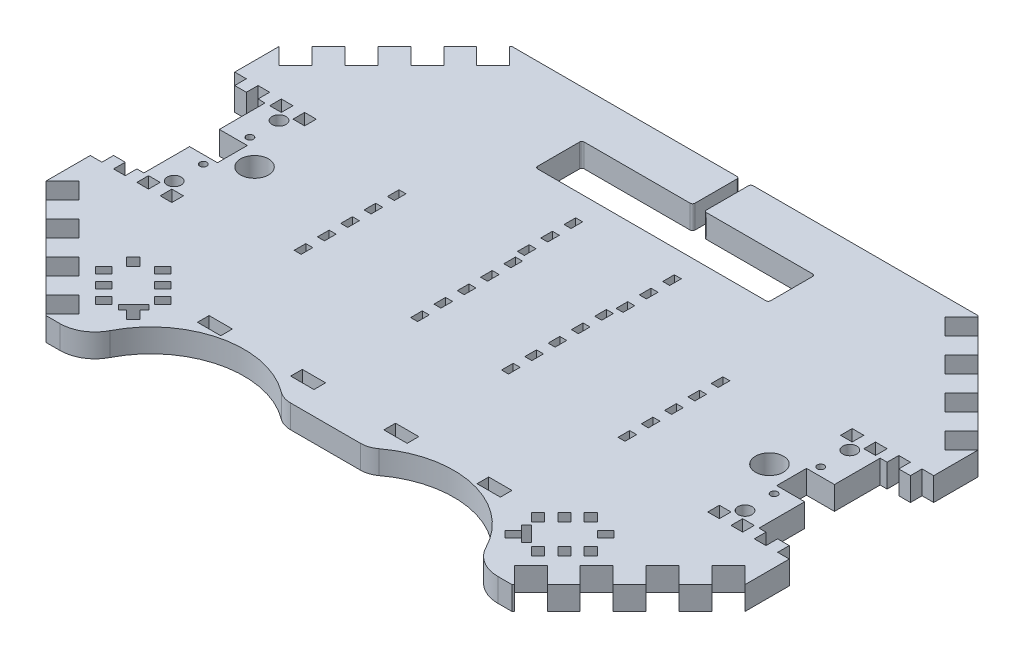
from build123d import *

# Parameters (mm, degrees)
ESQUISSE1_W                     = 300
ESQUISSE1_H                     = 200
BOSS_EXTRU_1_DEPTH              = 10
ENL_V_MAT_EXTRU_1_DEPTH         = 10
ESQUISSE4_W                     = 3
ESQUISSE4_H                     = 5
ENL_V_MAT_EXTRU_3_DEPTH         = 10
R_P_TITION_LIN_AIRE1_COUNT      = 5
R_P_TITION_LIN_AIRE1_PITCH      = 10
R_P_TITION_LIN_AIRE1_COUNT_DIR2 = 2
R_P_TITION_LIN_AIRE1_PITCH_DIR2 = 50
ESQUISSE8_R                     = 3
ENL_V_MAT_EXTRU_6_DEPTH         = 10
ESQUISSE14_R                    = 6
ESQUISSE14_R_2                  = 1.5
ENL_V_MAT_EXTRU_13_DEPTH        = 10
SYM_TRIE1_COPY_1_SKETCH_W       = 3
SYM_TRIE1_COPY_1_SKETCH_H       = 5
SYM_TRIE1_COPY_1_DEPTH          = 10
SYM_TRIE1_COPY_2_SKETCH_W       = 3
SYM_TRIE1_COPY_2_SKETCH_H       = 5
SYM_TRIE1_COPY_2_DEPTH          = 10
SYM_TRIE1_COPY_3_SKETCH_W       = 3
SYM_TRIE1_COPY_3_SKETCH_H       = 5
SYM_TRIE1_COPY_3_DEPTH          = 10
SYM_TRIE1_COPY_4_SKETCH_W       = 3
SYM_TRIE1_COPY_4_SKETCH_H       = 5
SYM_TRIE1_COPY_4_DEPTH          = 10
SYM_TRIE1_COPY_5_SKETCH_W       = 3
SYM_TRIE1_COPY_5_SKETCH_H       = 5
SYM_TRIE1_COPY_5_DEPTH          = 10
SYM_TRIE1_COPY_6_SKETCH_W       = 3
SYM_TRIE1_COPY_6_SKETCH_H       = 5
SYM_TRIE1_COPY_6_DEPTH          = 10
SYM_TRIE1_COPY_7_SKETCH_W       = 3
SYM_TRIE1_COPY_7_SKETCH_H       = 5
SYM_TRIE1_COPY_7_DEPTH          = 10
SYM_TRIE1_COPY_8_SKETCH_W       = 3
SYM_TRIE1_COPY_8_SKETCH_H       = 5
SYM_TRIE1_COPY_8_DEPTH          = 10
SYM_TRIE1_COPY_9_SKETCH_W       = 3
SYM_TRIE1_COPY_9_SKETCH_H       = 5
SYM_TRIE1_COPY_9_DEPTH          = 10
ESQUISSE3_R                     = 40
ENL_V_MAT_EXTRU_7_DEPTH         = 10
CONG_1_R                        = 15
ENL_V_MAT_EXTRU_11_DEPTH        = 10
R_P_TITION_LIN_AIRE2_COUNT      = 4
R_P_TITION_LIN_AIRE2_PITCH      = 20
SYM_TRIE2_COPY_1_DEPTH          = 10
SYM_TRIE2_COPY_2_DEPTH          = 10
SYM_TRIE2_COPY_3_DEPTH          = 10
SYM_TRIE3_COPY_1_DEPTH          = 10
SYM_TRIE3_COPY_2_DEPTH          = 10
SYM_TRIE3_COPY_3_DEPTH          = 10
SYM_TRIE3_COPY_4_DEPTH          = 10
SYM_TRIE3_COPY_5_DEPTH          = 10
SYM_TRIE3_COPY_6_DEPTH          = 10
SYM_TRIE3_COPY_7_DEPTH          = 10
ESQUISSE17_W                    = 10
ESQUISSE17_H                    = 5
ENL_V_MAT_EXTRU_16_DEPTH        = 10
R_P_TITION_LIN_AIRE3_COUNT      = 4
R_P_TITION_LIN_AIRE3_PITCH      = 40
ESQUISSE21_W                    = 43.542486889
ESQUISSE21_H                    = 20
ENL_V_MAT_EXTRU_20_DEPTH        = 10
CONG_2_R                        = 10
ESQUISSE22_W                    = 5
ESQUISSE22_H                    = 5
ENL_V_MAT_EXTRU_21_DEPTH        = 10
ESQUISSE23_W                    = 100
ESQUISSE23_H                    = 20
ENL_V_MAT_EXTRU_22_DEPTH        = 10
ESQUISSE24_W                    = 5
ESQUISSE24_H                    = 20
ENL_V_MAT_EXTRU_23_DEPTH        = 10
CONG_3_R                        = 1
ESQUISSE26_W                    = 3
ESQUISSE26_H                    = 5
ENL_V_MAT_EXTRU_25_DEPTH        = 10
ENL_V_MAT_EXTRU_26_DEPTH        = 10
ESQUISSE30_W                    = 18
ESQUISSE30_H                    = 52
ENL_V_MAT_EXTRU_27_DEPTH        = 10
ESQUISSE32_W                    = 12
ESQUISSE32_H                    = 12.8
ENL_V_MAT_EXTRU_28_DEPTH        = 10


with BuildPart() as part:
    # Esquisse1 → Boss.-Extru.1 (new body)
    with BuildSketch(Plane(origin=(0, 0, 0), x_dir=(1, 0, 0), z_dir=(0, 1, 0))):
        Rectangle(ESQUISSE1_W, ESQUISSE1_H)
    extrude(amount=BOSS_EXTRU_1_DEPTH)

    # Esquisse2 → Enlèv. mat.-Extru.1 (cut)
    with BuildSketch(Plane(origin=(0, 10, 0), x_dir=(1, 0, 0), z_dir=(0, 1, 0))):
        Polygon((-100, 100), (-150, 50), (-150, 100), align=None)
        Polygon((150, 100), (150, 50), (100, 100), align=None)
        Polygon((150, -100), (150, -50), (100, -100), align=None)
        Polygon((-100, -100), (-150, -100), (-150, -50), align=None)
    extrude(amount=-ENL_V_MAT_EXTRU_1_DEPTH, mode=Mode.SUBTRACT)

    # Esquisse4 → Enlèv. mat.-Extru.3 (cut)
    with BuildSketch(Plane(origin=(0, 10, 0), x_dir=(1, 0, 0), z_dir=(0, 1, 0))):
        with Locations((-19.5, 20)):
            Rectangle(ESQUISSE4_W, ESQUISSE4_H)
    enl_v_mat_extru_3 = extrude(amount=-ENL_V_MAT_EXTRU_3_DEPTH, mode=Mode.SUBTRACT)

    # Répétition linéaire1: Enl_v. mat.-Extru.3 5 × 2
    with Locations(*[(-j * R_P_TITION_LIN_AIRE1_PITCH_DIR2, 0, i * R_P_TITION_LIN_AIRE1_PITCH) for i in range(R_P_TITION_LIN_AIRE1_COUNT) for j in range(R_P_TITION_LIN_AIRE1_COUNT_DIR2) if (i, j) != (0, 0)]):
        add(enl_v_mat_extru_3, mode=Mode.SUBTRACT)

    # Esquisse8 → Enlèv. mat.-Extru.6 (cut)
    with BuildSketch(Plane(origin=(0, 10, 0), x_dir=(1, 0, 0), z_dir=(0, 1, 0))):
        with Locations(Location((-122.5, 22.5, 0), (0, 0, 270))):
            Circle(ESQUISSE8_R)
        with Locations(Location((-122.5, -22.5, 0), (0, 0, 270))):
            Circle(ESQUISSE8_R)
    enl_v_mat_extru_6 = extrude(amount=-ENL_V_MAT_EXTRU_6_DEPTH, mode=Mode.SUBTRACT)

    # Esquisse14 → Enlèv. mat.-Extru.13 (cut)
    with BuildSketch(Plane(origin=(0, 10, 0), x_dir=(1, 0, 0), z_dir=(0, 1, 0))):
        with Locations(Location((-110.5, 0, 0), (0, 0, 270))):
            Circle(ESQUISSE14_R)
        with Locations(Location((-122.5, 10, 0), (0, 0, 270))):
            Circle(ESQUISSE14_R_2)
        with Locations(Location((-122.5, -10, 0), (0, 0, 270))):
            Circle(ESQUISSE14_R_2)
    enl_v_mat_extru_13 = extrude(amount=-ENL_V_MAT_EXTRU_13_DEPTH, mode=Mode.SUBTRACT)

    # Symétrie1: Enlèv. mat.-Extru.3, Enlèv. mat.-Extru.6, Enlèv. mat.-Extru.13 across plane
    add(enl_v_mat_extru_3.mirror(Plane(origin=(0, 0, 0), x_dir=(0, 0, 1), z_dir=(1, 0, 0))), mode=Mode.SUBTRACT)
    add(enl_v_mat_extru_6.mirror(Plane(origin=(0, 0, 0), x_dir=(0, 0, 1), z_dir=(1, 0, 0))), mode=Mode.SUBTRACT)
    add(enl_v_mat_extru_13.mirror(Plane(origin=(0, 0, 0), x_dir=(0, 0, 1), z_dir=(1, 0, 0))), mode=Mode.SUBTRACT)

    # Symétrie1 copy 1 sketch → Symétrie1 copy 1 (cut)
    with BuildSketch(Plane(origin=(50, 10, 0), x_dir=(-1, 0, 0), z_dir=(0, 1, 0))):
        with Locations((-19.5, -20)):
            Rectangle(SYM_TRIE1_COPY_1_SKETCH_W, SYM_TRIE1_COPY_1_SKETCH_H)
    extrude(amount=-SYM_TRIE1_COPY_1_DEPTH, mode=Mode.SUBTRACT)

    # Symétrie1 copy 2 sketch → Symétrie1 copy 2 (cut)
    with BuildSketch(Plane(origin=(0, 10, 10), x_dir=(-1, 0, 0), z_dir=(0, 1, 0))):
        with Locations((-19.5, -20)):
            Rectangle(SYM_TRIE1_COPY_2_SKETCH_W, SYM_TRIE1_COPY_2_SKETCH_H)
    extrude(amount=-SYM_TRIE1_COPY_2_DEPTH, mode=Mode.SUBTRACT)

    # Symétrie1 copy 3 sketch → Symétrie1 copy 3 (cut)
    with BuildSketch(Plane(origin=(50, 10, 10), x_dir=(-1, 0, 0), z_dir=(0, 1, 0))):
        with Locations((-19.5, -20)):
            Rectangle(SYM_TRIE1_COPY_3_SKETCH_W, SYM_TRIE1_COPY_3_SKETCH_H)
    extrude(amount=-SYM_TRIE1_COPY_3_DEPTH, mode=Mode.SUBTRACT)

    # Symétrie1 copy 4 sketch → Symétrie1 copy 4 (cut)
    with BuildSketch(Plane(origin=(0, 10, 20), x_dir=(-1, 0, 0), z_dir=(0, 1, 0))):
        with Locations((-19.5, -20)):
            Rectangle(SYM_TRIE1_COPY_4_SKETCH_W, SYM_TRIE1_COPY_4_SKETCH_H)
    extrude(amount=-SYM_TRIE1_COPY_4_DEPTH, mode=Mode.SUBTRACT)

    # Symétrie1 copy 5 sketch → Symétrie1 copy 5 (cut)
    with BuildSketch(Plane(origin=(50, 10, 20), x_dir=(-1, 0, 0), z_dir=(0, 1, 0))):
        with Locations((-19.5, -20)):
            Rectangle(SYM_TRIE1_COPY_5_SKETCH_W, SYM_TRIE1_COPY_5_SKETCH_H)
    extrude(amount=-SYM_TRIE1_COPY_5_DEPTH, mode=Mode.SUBTRACT)

    # Symétrie1 copy 6 sketch → Symétrie1 copy 6 (cut)
    with BuildSketch(Plane(origin=(0, 10, 30), x_dir=(-1, 0, 0), z_dir=(0, 1, 0))):
        with Locations((-19.5, -20)):
            Rectangle(SYM_TRIE1_COPY_6_SKETCH_W, SYM_TRIE1_COPY_6_SKETCH_H)
    extrude(amount=-SYM_TRIE1_COPY_6_DEPTH, mode=Mode.SUBTRACT)

    # Symétrie1 copy 7 sketch → Symétrie1 copy 7 (cut)
    with BuildSketch(Plane(origin=(50, 10, 30), x_dir=(-1, 0, 0), z_dir=(0, 1, 0))):
        with Locations((-19.5, -20)):
            Rectangle(SYM_TRIE1_COPY_7_SKETCH_W, SYM_TRIE1_COPY_7_SKETCH_H)
    extrude(amount=-SYM_TRIE1_COPY_7_DEPTH, mode=Mode.SUBTRACT)

    # Symétrie1 copy 8 sketch → Symétrie1 copy 8 (cut)
    with BuildSketch(Plane(origin=(0, 10, 40), x_dir=(-1, 0, 0), z_dir=(0, 1, 0))):
        with Locations((-19.5, -20)):
            Rectangle(SYM_TRIE1_COPY_8_SKETCH_W, SYM_TRIE1_COPY_8_SKETCH_H)
    extrude(amount=-SYM_TRIE1_COPY_8_DEPTH, mode=Mode.SUBTRACT)

    # Symétrie1 copy 9 sketch → Symétrie1 copy 9 (cut)
    with BuildSketch(Plane(origin=(50, 10, 40), x_dir=(-1, 0, 0), z_dir=(0, 1, 0))):
        with Locations((-19.5, -20)):
            Rectangle(SYM_TRIE1_COPY_9_SKETCH_W, SYM_TRIE1_COPY_9_SKETCH_H)
    extrude(amount=-SYM_TRIE1_COPY_9_DEPTH, mode=Mode.SUBTRACT)

    # Esquisse3 → Enlèv. mat.-Extru.7 (cut)
    with BuildSketch(Plane(origin=(0, 10, 0), x_dir=(1, 0, 0), z_dir=(0, 1, 0))):
        with Locations((-45, -110)):
            Circle(ESQUISSE3_R)
        with Locations((45, -110)):
            Circle(ESQUISSE3_R)
    extrude(amount=-ENL_V_MAT_EXTRU_7_DEPTH, mode=Mode.SUBTRACT)

    # Congé1
    # the kernel refuses this fillet: 15 mm, written as the material it takes off along each edge
    with BuildSketch(Plane(origin=(-6.270166538, -25.649903484, 100), x_dir=(-0.35439878792981183, 0, -0.9350943797894843), z_dir=(0, 1, 0)), Plane(origin=(83.729833462, -25.649903484, 100), x_dir=(-0.3543987879298129, 0, -0.9350943797894838), z_dir=(0, 1, 0))) as cong_1_piece_1:
        with BuildLine():
            CenterArc((10.390297815, -14.910014055), CONG_1_R, 96.279089802, 62.964308211)
            Line((-3.636117882, -9.594032236), (0, 0))
            ThreePointArc((0, 0), (4.374862238, -0.23996252), (8.749724476, 0))
        make_face()
    extrude(amount=61.299806968, mode=Mode.SUBTRACT)
    with BuildSketch(Plane(origin=(-83.729833462, -25.649903484, 100), x_dir=(-1, 0, 0), z_dir=(0, 1, 0)), Plane(origin=(6.270166538, -25.649903484, 100), x_dir=(-1, 0, 0), z_dir=(0, 1, 0))) as cong_1_piece_2:
        with BuildLine():
            CenterArc((10.259961394, -15), CONG_1_R, 90, 62.964308211)
            ThreePointArc((-3.100891749, -8.181818182), (-1.32605827, -4.175951517), (0, 0))
            Line((0, 0), (10.259961394, 0))
        make_face()
    extrude(amount=61.299806968, mode=Mode.SUBTRACT)

    # Esquisse12 → Enlèv. mat.-Extru.11 (cut)
    with BuildSketch(Plane(origin=(0, 10, 0), x_dir=(1, 0, 0), z_dir=(0, 1, 0))):
        Polygon((-150, 50), (-142.928932188, 57.071067812), (-135.857864376, 50), (-142.928932188, 42.928932188), align=None)
    enl_v_mat_extru_11 = extrude(amount=-ENL_V_MAT_EXTRU_11_DEPTH, mode=Mode.SUBTRACT)

    # Répétition linéaire2: Enlèv. mat.-Extru.11 ×4
    with Locations(*[Vector(0.7071067811865476, 0, -0.7071067811865475) * (i * R_P_TITION_LIN_AIRE2_PITCH) for i in range(1, R_P_TITION_LIN_AIRE2_COUNT)]):
        add(enl_v_mat_extru_11, mode=Mode.SUBTRACT)

    # Symétrie2: Enlèv. mat.-Extru.11 across plane
    add(enl_v_mat_extru_11.mirror(Plane.XY), mode=Mode.SUBTRACT)

    # Symétrie2 copy 1 sketch → Symétrie2 copy 1 (cut)
    with BuildSketch(Plane(origin=(14.142135624, 10, 14.142135624), x_dir=(1, 0, 0), z_dir=(0, 1, 0))):
        Polygon((-150, -50), (-142.928932188, -57.071067812), (-135.857864376, -50), (-142.928932188, -42.928932188), align=None)
    extrude(amount=-SYM_TRIE2_COPY_1_DEPTH, mode=Mode.SUBTRACT)

    # Symétrie2 copy 2 sketch → Symétrie2 copy 2 (cut)
    with BuildSketch(Plane(origin=(28.284271247, 10, 28.284271247), x_dir=(1, 0, 0), z_dir=(0, 1, 0))):
        Polygon((-150, -50), (-142.928932188, -57.071067812), (-135.857864376, -50), (-142.928932188, -42.928932188), align=None)
    extrude(amount=-SYM_TRIE2_COPY_2_DEPTH, mode=Mode.SUBTRACT)

    # Symétrie2 copy 3 sketch → Symétrie2 copy 3 (cut)
    with BuildSketch(Plane(origin=(42.426406871, 10, 42.426406871), x_dir=(1, 0, 0), z_dir=(0, 1, 0))):
        Polygon((-150, -50), (-142.928932188, -57.071067812), (-135.857864376, -50), (-142.928932188, -42.928932188), align=None)
    extrude(amount=-SYM_TRIE2_COPY_3_DEPTH, mode=Mode.SUBTRACT)

    # Symétrie3: Enlèv. mat.-Extru.11 across plane
    add(enl_v_mat_extru_11.mirror(Plane(origin=(0, 0, 0), x_dir=(0, 0, 1), z_dir=(1, 0, 0))), mode=Mode.SUBTRACT)

    # Symétrie3 copy 1 sketch → Symétrie3 copy 1 (cut)
    with BuildSketch(Plane(origin=(-14.142135624, 10, -14.142135624), x_dir=(-1, 0, 0), z_dir=(0, 1, 0))):
        Polygon((-150, -50), (-142.928932188, -57.071067812), (-135.857864376, -50), (-142.928932188, -42.928932188), align=None)
    extrude(amount=-SYM_TRIE3_COPY_1_DEPTH, mode=Mode.SUBTRACT)

    # Symétrie3 copy 2 sketch → Symétrie3 copy 2 (cut)
    with BuildSketch(Plane(origin=(-28.284271247, 10, -28.284271247), x_dir=(-1, 0, 0), z_dir=(0, 1, 0))):
        Polygon((-150, -50), (-142.928932188, -57.071067812), (-135.857864376, -50), (-142.928932188, -42.928932188), align=None)
    extrude(amount=-SYM_TRIE3_COPY_2_DEPTH, mode=Mode.SUBTRACT)

    # Symétrie3 copy 3 sketch → Symétrie3 copy 3 (cut)
    with BuildSketch(Plane(origin=(-42.426406871, 10, -42.426406871), x_dir=(-1, 0, 0), z_dir=(0, 1, 0))):
        Polygon((-150, -50), (-142.928932188, -57.071067812), (-135.857864376, -50), (-142.928932188, -42.928932188), align=None)
    extrude(amount=-SYM_TRIE3_COPY_3_DEPTH, mode=Mode.SUBTRACT)

    # Symétrie3 copy 4 sketch → Symétrie3 copy 4 (cut)
    with BuildSketch(Plane(origin=(0, 10, 0), x_dir=(-1, 0, 0), z_dir=(0, 1, 0))):
        Polygon((-150, 50), (-142.928932188, 57.071067812), (-135.857864376, 50), (-142.928932188, 42.928932188), align=None)
    extrude(amount=-SYM_TRIE3_COPY_4_DEPTH, mode=Mode.SUBTRACT)

    # Symétrie3 copy 5 sketch → Symétrie3 copy 5 (cut)
    with BuildSketch(Plane(origin=(-14.142135624, 10, 14.142135624), x_dir=(-1, 0, 0), z_dir=(0, 1, 0))):
        Polygon((-150, 50), (-142.928932188, 57.071067812), (-135.857864376, 50), (-142.928932188, 42.928932188), align=None)
    extrude(amount=-SYM_TRIE3_COPY_5_DEPTH, mode=Mode.SUBTRACT)

    # Symétrie3 copy 6 sketch → Symétrie3 copy 6 (cut)
    with BuildSketch(Plane(origin=(-28.284271247, 10, 28.284271247), x_dir=(-1, 0, 0), z_dir=(0, 1, 0))):
        Polygon((-150, 50), (-142.928932188, 57.071067812), (-135.857864376, 50), (-142.928932188, 42.928932188), align=None)
    extrude(amount=-SYM_TRIE3_COPY_6_DEPTH, mode=Mode.SUBTRACT)

    # Symétrie3 copy 7 sketch → Symétrie3 copy 7 (cut)
    with BuildSketch(Plane(origin=(-42.426406871, 10, 42.426406871), x_dir=(-1, 0, 0), z_dir=(0, 1, 0))):
        Polygon((-150, 50), (-142.928932188, 57.071067812), (-135.857864376, 50), (-142.928932188, 42.928932188), align=None)
    extrude(amount=-SYM_TRIE3_COPY_7_DEPTH, mode=Mode.SUBTRACT)

    # Esquisse17 → Enlèv. mat.-Extru.16 (cut)
    with BuildSketch(Plane(origin=(0, 10, 0), x_dir=(1, 0, 0), z_dir=(0, 1, 0))):
        with Locations((-60, -67.5)):
            Rectangle(ESQUISSE17_W, ESQUISSE17_H)
    enl_v_mat_extru_16 = extrude(amount=-ENL_V_MAT_EXTRU_16_DEPTH, mode=Mode.SUBTRACT)

    # Répétition linéaire3: Enlèv. mat.-Extru.16 ×4
    with Locations(*[(i * R_P_TITION_LIN_AIRE3_PITCH, 0, 0) for i in range(1, R_P_TITION_LIN_AIRE3_COUNT)]):
        add(enl_v_mat_extru_16, mode=Mode.SUBTRACT)

    # Esquisse21 → Enlèv. mat.-Extru.20 (cut)
    with BuildSketch(Plane(origin=(0, 10, 0), x_dir=(1, 0, 0), z_dir=(0, 1, 0))):
        with Locations((3.228756555, -90)):
            Rectangle(ESQUISSE21_W, ESQUISSE21_H)
    extrude(amount=-ENL_V_MAT_EXTRU_20_DEPTH, mode=Mode.SUBTRACT)

    # Congé2
    cong_2_edges = [part.edges().sort_by_distance(p)[0] for p in [
        (18.542486889, 5, 80),
        (-18.542486889, 5, 80),
    ]]
    fillet(cong_2_edges, radius=CONG_2_R)

    # Esquisse22 → Enlèv. mat.-Extru.21 (cut)
    with BuildSketch(Plane(origin=(0, 10, 0), x_dir=(1, 0, 0), z_dir=(0, 1, 0))):
        with Locations((-137.5, 28.5)):
            Rectangle(ESQUISSE22_W, ESQUISSE22_H)
        with Locations((-117.5, 28.5)):
            Rectangle(ESQUISSE22_W, ESQUISSE22_H)
        with Locations((-127.5, 28.5)):
            Rectangle(ESQUISSE22_W, ESQUISSE22_H)
        with Locations((-147.5, 28.5)):
            Rectangle(ESQUISSE22_W, ESQUISSE22_H)
        with Locations((-117.5, -28.5)):
            Rectangle(ESQUISSE22_W, ESQUISSE22_H)
        with Locations((-127.5, -28.5)):
            Rectangle(ESQUISSE22_W, ESQUISSE22_H)
        with Locations((-147.5, -28.5)):
            Rectangle(ESQUISSE22_W, ESQUISSE22_H)
        with Locations((-137.5, -28.5)):
            Rectangle(ESQUISSE22_W, ESQUISSE22_H)
        with Locations((137.5, -28.5)):
            Rectangle(ESQUISSE22_W, ESQUISSE22_H)
        with Locations((117.5, -28.5)):
            Rectangle(ESQUISSE22_W, ESQUISSE22_H)
        with Locations((127.5, -28.5)):
            Rectangle(ESQUISSE22_W, ESQUISSE22_H)
        with Locations((147.5, -28.5)):
            Rectangle(ESQUISSE22_W, ESQUISSE22_H)
        with Locations((117.5, 28.5)):
            Rectangle(ESQUISSE22_W, ESQUISSE22_H)
        with Locations((127.5, 28.5)):
            Rectangle(ESQUISSE22_W, ESQUISSE22_H)
        with Locations((147.5, 28.5)):
            Rectangle(ESQUISSE22_W, ESQUISSE22_H)
        with Locations((137.5, 28.5)):
            Rectangle(ESQUISSE22_W, ESQUISSE22_H)
    extrude(amount=-ENL_V_MAT_EXTRU_21_DEPTH, mode=Mode.SUBTRACT)

    # Esquisse23 → Enlèv. mat.-Extru.22 (cut)
    with BuildSketch(Plane(origin=(0, 10, 0), x_dir=(1, 0, 0), z_dir=(0, 1, 0))):
        with Locations((0, 70)):
            Rectangle(ESQUISSE23_W, ESQUISSE23_H)
    extrude(amount=-ENL_V_MAT_EXTRU_22_DEPTH, mode=Mode.SUBTRACT)

    # Esquisse24 → Enlèv. mat.-Extru.23 (cut)
    with BuildSketch(Plane(origin=(0, 10, 0), x_dir=(1, 0, 0), z_dir=(0, 1, 0))):
        with Locations((0, 90)):
            Rectangle(ESQUISSE24_W, ESQUISSE24_H)
    extrude(amount=-ENL_V_MAT_EXTRU_23_DEPTH, mode=Mode.SUBTRACT)

    # Congé3
    cong_3_edges = [part.edges().sort_by_distance(p)[0] for p in [
        (-50, 5, -60),
        (-50, 5, -80),
        (50, 5, -80),
        (50, 5, -60),
        (2.5, 5, -100),
        (2.5, 5, -80),
        (-2.5, 5, -80),
        (-2.5, 5, -100),
    ]]
    fillet(cong_3_edges, radius=CONG_3_R)

    # Esquisse26 → Enlèv. mat.-Extru.25 (cut)
    with BuildSketch(Plane(origin=(0, 10, 0), x_dir=(1, 0, 0), z_dir=(0, 1, 0))):
        with Locations((21.17, 37.5)):
            Rectangle(ESQUISSE26_W, ESQUISSE26_H)
        with Locations((21.17, 47.5)):
            Rectangle(ESQUISSE26_W, ESQUISSE26_H)
        with Locations((21.17, 27.5)):
            Rectangle(ESQUISSE26_W, ESQUISSE26_H)
        with Locations((-21.17, 27.5)):
            Rectangle(ESQUISSE26_W, ESQUISSE26_H)
        with Locations((-21.17, 37.5)):
            Rectangle(ESQUISSE26_W, ESQUISSE26_H)
        with Locations((-21.17, 47.5)):
            Rectangle(ESQUISSE26_W, ESQUISSE26_H)
    extrude(amount=-ENL_V_MAT_EXTRU_25_DEPTH, mode=Mode.SUBTRACT)

    # Esquisse29 → Enlèv. mat.-Extru.26 (cut)
    with BuildSketch(Plane.XZ):
        Polygon((-98.162695037, 61.532218436), (-100.991122162, 64.36064556), (-104.526656068, 60.825111654), (-101.698228943, 57.99668453), align=None)
        Polygon((88.616753491, 80.270548137), (86.495433147, 82.391868481), (84.727666194, 80.624101528), (81.192132288, 84.159635434), (78.363705164, 81.331208309), (81.89923907, 77.795674403), (79.928516831, 75.824952164), (82.049837174, 73.70363182), align=None)
        Polygon((-104.173102677, 67.542626076), (-101.344675552, 70.3710532), (-104.880209458, 73.906587106), (-107.708636583, 71.078159982), align=None)
        Polygon((-90.030967053, 81.684761699), (-93.566500959, 85.220295605), (-96.394928084, 82.391868481), (-92.859394178, 78.856334575), align=None)
        Polygon((-78.363705164, 81.331208309), (-81.192132288, 84.159635434), (-84.727666194, 80.624101528), (-86.495433147, 82.391868481), (-88.616753491, 80.270548137), (-82.049837174, 73.70363182), (-79.928516831, 75.824952164), (-81.89923907, 77.795674403), align=None)
        Polygon((-80.838578898, 72.492373544), (-83.667006023, 69.663946419), (-80.131472117, 66.128412513), (-77.303044992, 68.956839638), align=None)
        Polygon((-92.152287397, 61.178665045), (-94.980714521, 58.35023792), (-91.445180616, 54.814704014), (-88.616753491, 57.643131139), align=None)
        Polygon((-98.516248427, 73.199480325), (-95.687821303, 76.02790745), (-99.223355209, 79.563441356), (-102.051782333, 76.735014231), align=None)
        Polygon((-86.495433147, 66.835519294), (-89.323860272, 64.00709217), (-85.788326366, 60.471558264), (-82.959899241, 63.299985388), align=None)
        Polygon((82.959899241, 63.299985388), (85.788326366, 60.471558264), (89.323860272, 64.00709217), (86.495433147, 66.835519294), align=None)
        Polygon((95.687821303, 76.02790745), (98.516248427, 73.199480325), (102.051782333, 76.735014231), (99.223355209, 79.563441356), align=None)
        Polygon((88.616753491, 57.643131139), (91.445180616, 54.814704014), (94.980714521, 58.35023792), (92.152287397, 61.178665045), align=None)
        Polygon((77.303044992, 68.956839638), (80.131472117, 66.128412513), (83.667006023, 69.663946419), (80.838578898, 72.492373544), align=None)
        Polygon((92.859394178, 78.856334575), (96.394928084, 82.391868481), (93.566500959, 85.220295605), (90.030967053, 81.684761699), align=None)
        Polygon((101.344675552, 70.3710532), (104.173102677, 67.542626076), (107.708636583, 71.078159982), (104.880209458, 73.906587106), align=None)
        Polygon((100.991122162, 64.36064556), (98.162695037, 61.532218436), (101.698228943, 57.99668453), (104.526656068, 60.825111654), align=None)
    extrude(amount=-ENL_V_MAT_EXTRU_26_DEPTH, mode=Mode.SUBTRACT)

    # Esquisse30 → Enlèv. mat.-Extru.27 (cut)
    with BuildSketch(Plane.XZ):
        with Locations((141, 0)):
            Rectangle(ESQUISSE30_W, ESQUISSE30_H)
        with Locations((-141, 0)):
            Rectangle(ESQUISSE30_W, ESQUISSE30_H)
    extrude(amount=-ENL_V_MAT_EXTRU_27_DEPTH, mode=Mode.SUBTRACT)

    # Esquisse32 → Enlèv. mat.-Extru.28 (cut)
    with BuildSketch(Plane.XZ):
        with Locations((126, 0)):
            Rectangle(ESQUISSE32_W, ESQUISSE32_H)
        with Locations((-126, 0)):
            Rectangle(ESQUISSE32_W, ESQUISSE32_H)
    extrude(amount=-ENL_V_MAT_EXTRU_28_DEPTH, mode=Mode.SUBTRACT)


solid = part.part
